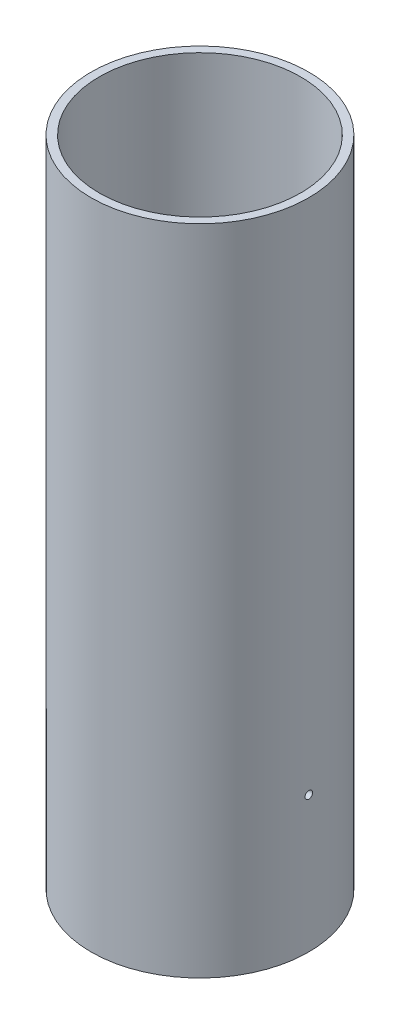
from build123d import *

# Parameters (mm, degrees)
SKETCH1_R           = 50.8
SKETCH1_R_2         = 46.99
BOSS_EXTRUDE1_DEPTH = 304.8
CUT_EXTRUDE1_REACH  = 327.279
SKETCH2_R           = 1.7526
CIRPATTERN1_COUNT   = 2


with BuildPart() as part:
    # Sketch1 → Boss-Extrude1 (new body)
    with BuildSketch(Plane(origin=(0, 0, 0), x_dir=(1, 0, 0), z_dir=(0, 1, 0))):
        Circle(SKETCH1_R)
        Circle(SKETCH1_R_2, mode=Mode.SUBTRACT)
    extrude(amount=BOSS_EXTRUDE1_DEPTH)

    # Sketch2 → Cut-Extrude1 (cut, up to next)
    with BuildSketch(Plane(origin=(50.8, 0, 0), x_dir=(0, 0, -1), z_dir=(1, 0, 0)), mode=Mode.PRIVATE) as cut_extrude1_sk1:
        with Locations((0, 63.5)):
            Circle(SKETCH2_R)
    cut_extrude1_tool1 = extrude(cut_extrude1_sk1.sketch, amount=-CUT_EXTRUDE1_REACH, mode=Mode.PRIVATE) & part.part
    cut_extrude1 = cut_extrude1_tool1.solids().sort_by_distance((50.8, 63.5, 0))[0]
    add(cut_extrude1, mode=Mode.SUBTRACT)

    # CirPattern1: Cut-Extrude1 ×2 about axis
    cirpattern1_axis = Axis((0, 0, 0), (0, 1, 0))
    for i in range(1, CIRPATTERN1_COUNT):
        add(cut_extrude1.rotate(cirpattern1_axis, i * 360 / CIRPATTERN1_COUNT), mode=Mode.SUBTRACT)


solid = part.part
